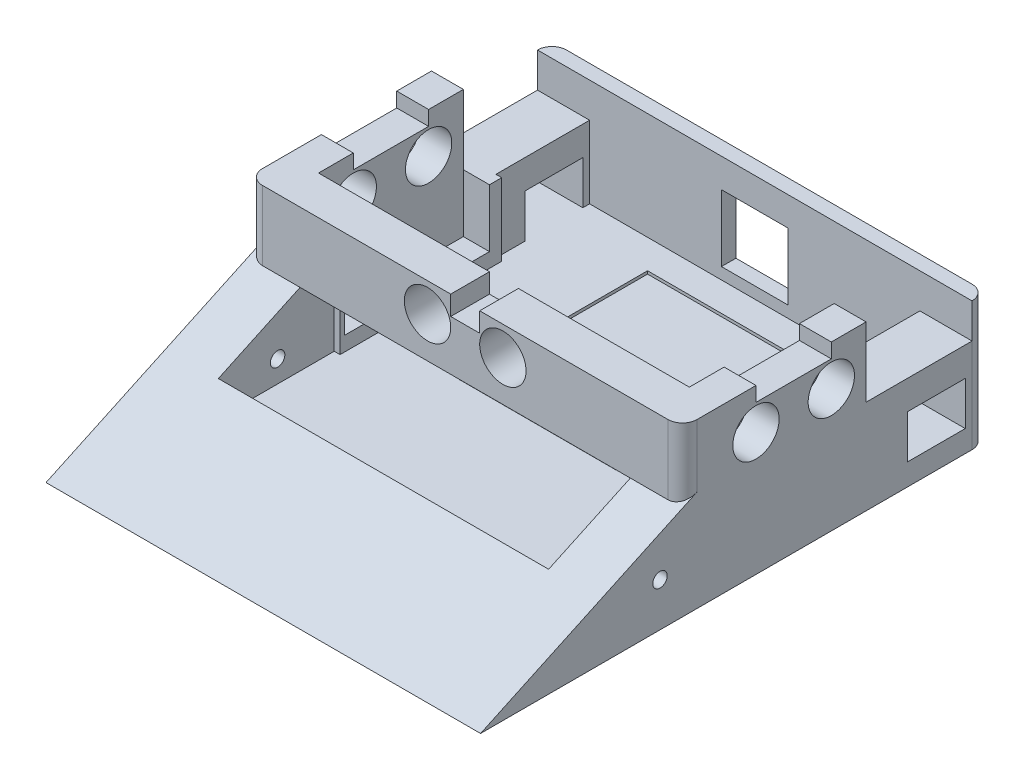
from build123d import *

# Parameters (mm, degrees)
SKETCH1_W                = 150
SKETCH1_H                = 180
BOSS_EXTRUDE2_DEPTH      = 7.5
BOSS_EXTRUDE4_DEPTH      = 18
BOSS_EXTRUDE5_DEPTH      = 18
SKETCH6_W                = 20
SKETCH6_H                = 15
BOSS_EXTRUDE7_DEPTH      = 18
BOSS_EXTRUDE8_DEPTH      = 22
BOSS_EXTRUDE8_DEPTH_BACK = 172
SKETCH7_R                = 2.5
SKETCH8_W                = 20
SKETCH8_H                = 15
BOSS_EXTRUDE9_DEPTH      = 18
SKETCH9_W                = 55.809879822
SKETCH9_H                = 25
BOSS_EXTRUDE10_DEPTH     = 20
SKETCH10_W               = 55.809879822
SKETCH10_H               = 25
BOSS_EXTRUDE11_DEPTH     = 20
CHAMFER2_SIZE            = 10
CHAMFER2_SIZE_2          = 21.445069205
SKETCH12_R               = 8
BOSS_EXTRUDE12_DEPTH     = 11
SKETCH13_W               = 50
SKETCH13_H               = 2
BOSS_EXTRUDE13_DEPTH     = 11
SKETCH14_W               = 26
SKETCH14_H               = 4.425411463
CUT_EXTRUDE1_DEPTH       = 11
SKETCH15_W               = 9
SKETCH15_H               = 49.984045424
CUT_EXTRUDE2_DEPTH       = 20
BOSS_EXTRUDE14_START     = -11
SKETCH16_W               = 50
SKETCH16_H               = 24
SKETCH16_R               = 8
SKETCH16_W_2             = 26
SKETCH16_H_2             = 4.425411463
BOSS_EXTRUDE14_DEPTH     = 11
SKETCH17_W               = 9
SKETCH17_H               = 49.996535525
CUT_EXTRUDE3_DEPTH       = 20
SKETCH20_W               = 114
SKETCH20_H               = 5
BOSS_EXTRUDE15_DEPTH     = 25
CUT_EXTRUDE4_DEPTH       = 1
CUT_EXTRUDE5_DEPTH       = 20
BOSS_EXTRUDE16_DEPTH     = 50
CUT_EXTRUDE6_DEPTH       = 50
BOSS_EXTRUDE17_DEPTH     = 50
SKETCH27_W               = 150
SKETCH27_H               = 12
BOSS_EXTRUDE18_DEPTH     = 5
CUT_EXTRUDE7_DEPTH       = 5
SKETCH29_W               = 150
SKETCH29_H               = 13.367257782
BOSS_EXTRUDE19_DEPTH     = 24
SKETCH30_W               = 50
SKETCH30_H               = 25.404930795
BOSS_EXTRUDE20_DEPTH     = 12
CUT_EXTRUDE10_DEPTH      = 50
SKETCH32_R               = 8
CUT_EXTRUDE13_DEPTH      = 50
SKETCH33_W               = 10
SKETCH33_H               = 6.701665097
CUT_EXTRUDE14_DEPTH      = 50
FILLET1_R                = 5
FILLET2_R                = 5
FILLET3_R                = 5
FILLET4_R                = 5
CUT_EXTRUDE15_START      = -200
SKETCH34_R               = 2.5
CUT_EXTRUDE15_DEPTH      = 200
CUT_EXTRUDE16_DEPTH      = 200
CUT_EXTRUDE17_DEPTH      = 200


with BuildPart() as part:
    # Sketch1 → Boss-Extrude2 (new body)
    with BuildSketch(Plane(origin=(0, 0, 0), x_dir=(1, 0, 0), z_dir=(0, 1, 0))):
        with Locations((75, 90)):
            Rectangle(SKETCH1_W, SKETCH1_H)
    extrude(amount=BOSS_EXTRUDE2_DEPTH)

    # Sketch2 → Boss-Extrude4 (add)
    with BuildSketch(Plane(origin=(150, 0, 0), x_dir=(0, 0, -1), z_dir=(1, 0, 0))):
        Polygon((76.85, 7.5), (86.85, 7.5), (86.85, 32.5), (46.85, 32.5), (46.85, 7.5), (50, 7.5), (56.85, 7.5), (56.85, 22.5), (76.85, 22.5), align=None)
        Polygon((172.659879822, 7.5), (180, 7.5), (180, 32.5), (142.659879822, 32.5), (142.659879822, 7.5), (152.659879822, 7.5), (152.659879822, 22.5), (172.659879822, 22.5), align=None)
    extrude(amount=-BOSS_EXTRUDE4_DEPTH)

    # Sketch4 → Boss-Extrude5 (add)
    with BuildSketch(Plane.ZY):
        Polygon((-180, 7.5), (-180, 32.5), (-142.659879822, 32.5), (-142.659879822, 7.5), (-152.659879822, 7.5), (-152.659879822, 22.5), (-172.659879822, 22.5), (-172.659879822, 7.5), align=None)
        Polygon((-86.85, 7.5), (-86.85, 32.5), (-46.85, 32.5), (-46.85, 7.5), (-56.85, 7.5), (-56.85, 22.5), (-76.85, 22.5), (-76.85, 7.5), align=None)
    extrude(amount=-BOSS_EXTRUDE5_DEPTH)

    # Sketch6 → Boss-Extrude7 (add)
    with BuildSketch(Plane(origin=(150, 0, 0), x_dir=(0, 0, -1), z_dir=(1, 0, 0))):
        with Locations((66.85, 15)):
            Rectangle(SKETCH6_W, SKETCH6_H)
    extrude(amount=-BOSS_EXTRUDE7_DEPTH)

    # Sketch7 → Boss-Extrude8 (add, two sides: drawn at the far end of the back side and taken through both)
    with BuildSketch(Plane(origin=(150, 0, 0), x_dir=(0, 0, -1), z_dir=(1, 0, 0)).offset(-BOSS_EXTRUDE8_DEPTH_BACK)):
        with Locations((67.3, 15)):
            Circle(SKETCH7_R)
    extrude(amount=BOSS_EXTRUDE8_DEPTH + BOSS_EXTRUDE8_DEPTH_BACK)

    # Sketch8 → Boss-Extrude9 (add)
    with BuildSketch(Plane.ZY):
        with Locations((-66.85, 15)):
            Rectangle(SKETCH8_W, SKETCH8_H)
    extrude(amount=-BOSS_EXTRUDE9_DEPTH)

    # Sketch9 → Boss-Extrude10 (add)
    with BuildSketch(Plane(origin=(150, 0, 0), x_dir=(0, 0, -1), z_dir=(1, 0, 0))):
        with Locations((114.754939911, 20)):
            Rectangle(SKETCH9_W, SKETCH9_H)
    extrude(amount=-BOSS_EXTRUDE10_DEPTH)

    # Sketch10 → Boss-Extrude11 (add)
    with BuildSketch(Plane.ZY):
        with Locations((-114.754939911, 20)):
            Rectangle(SKETCH10_W, SKETCH10_H)
    extrude(amount=-BOSS_EXTRUDE11_DEPTH)

    # Chamfer2
    # the kernel refuses this chamfer: 21.445069205, 10 mm, written as the material it takes off along each edge
    with BuildSketch(Plane(origin=(-55.563648293, 7.5, 0), x_dir=(0, -0.9971975577536774, 0.07481330637060031), z_dir=(1, 0, 0))) as chamfer2_piece_1:
        Polygon((CHAMFER2_SIZE * 0.997197557754, CHAMFER2_SIZE * 0.0748133063706), (-CHAMFER2_SIZE_2 * 0.0748133063709, CHAMFER2_SIZE_2 * 0.997197557758), (0, 0), align=None)
    extrude(amount=261.127296587, mode=Mode.SUBTRACT)

    # Sketch12 → Boss-Extrude12 (add)
    with BuildSketch(Plane(origin=(150, 0, 0), x_dir=(0, 0, -1), z_dir=(1, 0, 0))):
        Polygon((100.425, 32.5), (113.425, 32.5), (126.425, 32.5), (138.425, 32.5), (138.425, 42.5), (138.425, 54.5), (88.425, 54.5), (88.425, 42.5), (88.425, 32.5), align=None)
        with Locations((100.425, 42.5)):
            Circle(SKETCH12_R, mode=Mode.SUBTRACT)
        with Locations((126.425, 42.5)):
            Circle(SKETCH12_R, mode=Mode.SUBTRACT)
    extrude(amount=-BOSS_EXTRUDE12_DEPTH)

    # Sketch13 → Boss-Extrude13 (add)
    with BuildSketch(Plane(origin=(150, 0, 0), x_dir=(0, 0, -1), z_dir=(1, 0, 0))):
        with Locations((113.425, 55.5)):
            Rectangle(SKETCH13_W, SKETCH13_H)
    extrude(amount=-BOSS_EXTRUDE13_DEPTH)

    # Sketch14 → Cut-Extrude1 (cut)
    with BuildSketch(Plane(origin=(150, 0, 0), x_dir=(0, 0, -1), z_dir=(1, 0, 0))):
        with Locations((113.425, 53.660783617)):
            Rectangle(SKETCH14_W, SKETCH14_H)
    extrude(amount=-CUT_EXTRUDE1_DEPTH, mode=Mode.SUBTRACT)

    # Sketch15 → Cut-Extrude2 (cut)
    with BuildSketch(Plane(origin=(0, 32.5, 0), x_dir=(1, 0, 0), z_dir=(0, 1, 0))):
        with Locations((134.5, 113.432977288)):
            Rectangle(SKETCH15_W, SKETCH15_H)
    extrude(amount=-CUT_EXTRUDE2_DEPTH, mode=Mode.SUBTRACT)

    # Sketch16 → Boss-Extrude14 (add)
    with BuildSketch(Plane.ZY.offset(BOSS_EXTRUDE14_START)):
        with Locations((-113.425, 44.5)):
            Rectangle(SKETCH16_W, SKETCH16_H)
        with Locations(Location((-126.425, 42.5, 0), (0, 0, 180))):
            Circle(SKETCH16_R, mode=Mode.SUBTRACT)
        with Locations(Location((-100.425, 42.5, 0), (0, 0, 180))):
            Circle(SKETCH16_R, mode=Mode.SUBTRACT)
        with Locations((-113.425, 53.660783617)):
            Rectangle(SKETCH16_W_2, SKETCH16_H_2, mode=Mode.SUBTRACT)
    extrude(amount=BOSS_EXTRUDE14_DEPTH)

    # Sketch17 → Cut-Extrude3 (cut)
    with BuildSketch(Plane(origin=(0, 32.5, 0), x_dir=(1, 0, 0), z_dir=(0, 1, 0))):
        with Locations((15.5, 113.426732238)):
            Rectangle(SKETCH17_W, SKETCH17_H)
    extrude(amount=-CUT_EXTRUDE3_DEPTH, mode=Mode.SUBTRACT)

    # Sketch20 → Boss-Extrude15 (add)
    with BuildSketch(Plane(origin=(0, 7.5, 0), x_dir=(1, 0, 0), z_dir=(0, 1, 0))):
        with Locations((75, 177.5)):
            Rectangle(SKETCH20_W, SKETCH20_H)
    extrude(amount=BOSS_EXTRUDE15_DEPTH)

    # Sketch21 → Cut-Extrude4 (cut)
    with BuildSketch(Plane(origin=(0, 7.5, 0), x_dir=(1, 0, 0), z_dir=(0, 1, 0))):
        Polygon((48, 165), (75, 165), (102, 165), (102, 100), (48, 100), align=None)
    extrude(amount=-CUT_EXTRUDE4_DEPTH, mode=Mode.SUBTRACT)

    # Sketch22 → Cut-Extrude5 (cut)
    with BuildSketch(Plane(origin=(150, 0, 0), x_dir=(0, 0, -1), z_dir=(1, 0, 0))):
        Polygon((21.445069205, 7.5), (46.85, 19.346513785), (75.057742218, 32.5), (21.445069205, 32.5), align=None)
    extrude(amount=-CUT_EXTRUDE5_DEPTH, mode=Mode.SUBTRACT)

    # Sketch23 → Boss-Extrude16 (add)
    with BuildSketch(Plane(origin=(150, 0, 0), x_dir=(0, 0, -1), z_dir=(1, 0, 0))):
        Polygon((21.445069205, 7.5), (46.85, 19.346513785), (46.85, 7.5), align=None)
    extrude(amount=-BOSS_EXTRUDE16_DEPTH)

    # Sketch24 → Cut-Extrude6 (cut)
    with BuildSketch(Plane.ZY):
        Polygon((-21.445069205, 7.5), (-75.057742218, 32.5), (-21.445069205, 32.5), align=None)
    extrude(amount=-CUT_EXTRUDE6_DEPTH, mode=Mode.SUBTRACT)

    # Sketch25 → Boss-Extrude17 (add)
    with BuildSketch(Plane.ZY):
        Polygon((-46.85, 19.346513785), (-46.85, 7.5), (-21.445069205, 7.5), align=None)
    extrude(amount=-BOSS_EXTRUDE17_DEPTH)

    # Sketch27 → Boss-Extrude18 (add)
    with BuildSketch(Plane(origin=(0, 0, -180), x_dir=(-1, 0, 0), z_dir=(0, 0, -1))):
        with Locations((-75, 38.5)):
            Rectangle(SKETCH27_W, SKETCH27_H)
    extrude(amount=-BOSS_EXTRUDE18_DEPTH)

    # Sketch28 → Cut-Extrude7 (cut)
    with BuildSketch(Plane(origin=(0, 0, -180), x_dir=(-1, 0, 0), z_dir=(0, 0, -1))):
        Polygon((-75, 34.5), (-63.5, 34.5), (-63.5, 11.5), (-86.5, 11.5), (-86.5, 34.5), align=None)
    extrude(amount=-CUT_EXTRUDE7_DEPTH, mode=Mode.SUBTRACT)

    # Sketch29 → Boss-Extrude19 (add)
    with BuildSketch(Plane(origin=(0, 32.5, 0), x_dir=(1, 0, 0), z_dir=(0, 1, 0))):
        with Locations((75, 81.741371109)):
            Rectangle(SKETCH29_W, SKETCH29_H)
    extrude(amount=BOSS_EXTRUDE19_DEPTH)

    # Sketch30 → Boss-Extrude20 (add)
    with BuildSketch(Plane(origin=(0, 7.5, 0), x_dir=(1, 0, 0), z_dir=(0, 1, 0))):
        with Locations((75, 34.147534603)):
            Rectangle(SKETCH30_W, SKETCH30_H)
    extrude(amount=BOSS_EXTRUDE20_DEPTH)

    # Sketch31 → Cut-Extrude10 (cut)
    with BuildSketch(Plane(origin=(100, 0, 0), x_dir=(0, 0, -1), z_dir=(1, 0, 0))):
        Polygon((48.364168982, 20.052582377), (21.328861381, 20.052582377), (21.445069205, 7.5), align=None)
    extrude(amount=-CUT_EXTRUDE10_DEPTH, mode=Mode.SUBTRACT)

    # Sketch32 → Cut-Extrude13 (cut)
    with BuildSketch(Plane.XY.offset(-75.057742218)):
        with Locations((62, 46.5)):
            Circle(SKETCH32_R)
        with Locations((88, 46.5)):
            Circle(SKETCH32_R)
    extrude(amount=-CUT_EXTRUDE13_DEPTH, mode=Mode.SUBTRACT)

    # Sketch33 → Cut-Extrude14 (cut)
    with BuildSketch(Plane.XY.offset(-75.057742218)):
        with Locations((75, 53.149167452)):
            Rectangle(SKETCH33_W, SKETCH33_H)
    extrude(amount=-CUT_EXTRUDE14_DEPTH, mode=Mode.SUBTRACT)

    # Fillet1
    fillet1_edges = [part.edges().sort_by_distance(p)[0] for p in [
        (0, 44.5, -75.057742218),
    ]]
    fillet(fillet1_edges, radius=FILLET1_R)

    # Fillet2
    fillet2_edges = [part.edges().sort_by_distance(p)[0] for p in [
        (150, 44.5, -75.057742218),
    ]]
    fillet(fillet2_edges, radius=FILLET2_R)

    # Fillet3
    fillet3_edges = [part.edges().sort_by_distance(p)[0] for p in [
        (150, 22.25, -180),
    ]]
    fillet(fillet3_edges, radius=FILLET3_R)

    # Fillet4
    fillet4_edges = [part.edges().sort_by_distance(p)[0] for p in [
        (0, 22.25, -180),
    ]]
    fillet(fillet4_edges, radius=FILLET4_R)

    # Sketch34 → Cut-Extrude15 (cut)
    with BuildSketch(Plane.ZY.offset(22).offset(CUT_EXTRUDE15_START)):
        with Locations(Location((-67.3, 15, 0), (0, 0, 180))):
            Circle(SKETCH34_R)
    extrude(amount=CUT_EXTRUDE15_DEPTH, mode=Mode.SUBTRACT)

    # Sketch35 → Cut-Extrude16 (cut)
    with BuildSketch(Plane.ZY):
        Polygon((-126.425, 55.873489348), (-126.425, 56.5), (-100.505365538, 56.5), (-100.425, 55.873489348), align=None)
    extrude(amount=-CUT_EXTRUDE16_DEPTH, mode=Mode.SUBTRACT)

    # Sketch36 → Cut-Extrude17 (cut)
    with BuildSketch(Plane.ZY):
        Polygon((-100.425, 55.873489348), (-100.425, 56.5), (-100.505365538, 56.5), align=None)
    extrude(amount=-CUT_EXTRUDE17_DEPTH, mode=Mode.SUBTRACT)


solid = part.part
